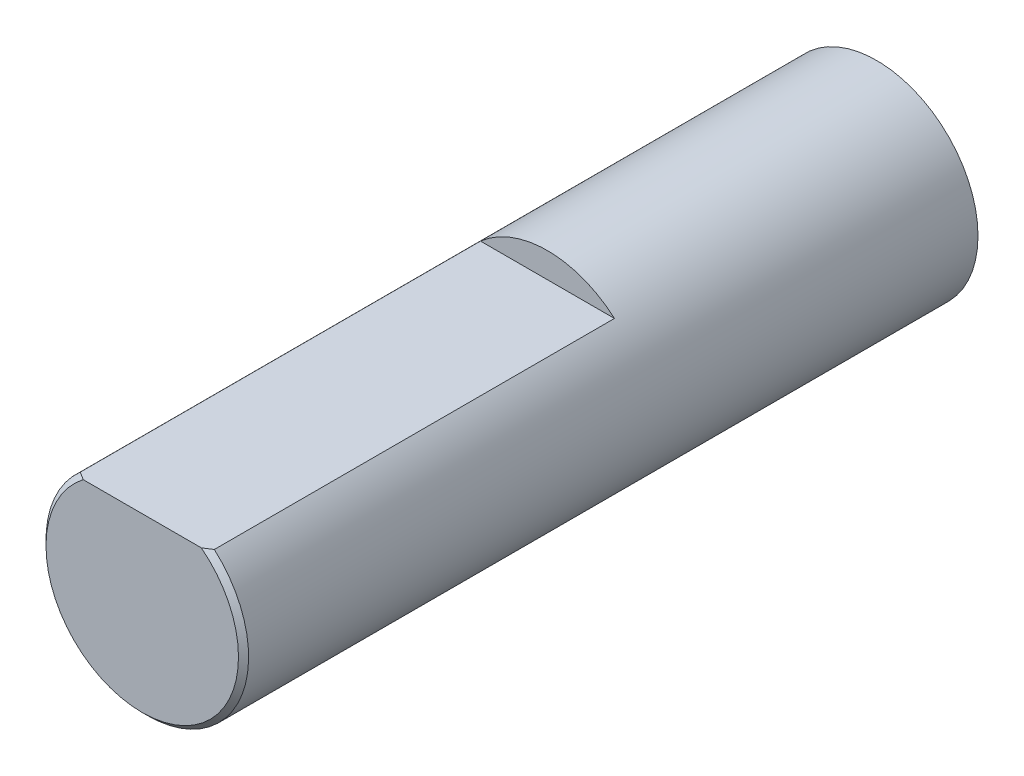
from build123d import *

# Parameters (mm, degrees)
SKETCH1_R           = 2
BOSS_EXTRUDE1_DEPTH = 14.5
CUT_EXTRUDE1_START  = -8
CUT_EXTRUDE1_DEPTH  = 8
CHAMFER1_SIZE       = 0.1


with BuildPart() as part:
    # Sketch1 → Boss-Extrude1 (new body)
    with BuildSketch(Plane.XY):
        Circle(SKETCH1_R)
    extrude(amount=BOSS_EXTRUDE1_DEPTH)

    # Sketch2 → Cut-Extrude1 (cut)
    with BuildSketch(Plane.XY.offset(14.5).offset(CUT_EXTRUDE1_START)):
        with BuildLine():
            Line((-1.322875656, 1.5), (1.322875656, 1.5))
            ThreePointArc((1.322875656, 1.5), (0, 2), (-1.322875656, 1.5))
        make_face()
    extrude(amount=CUT_EXTRUDE1_DEPTH, mode=Mode.SUBTRACT)

    # Chamfer1
    chamfer1_edges = [part.edges().sort_by_distance(p)[0] for p in [
        (-0.822875656, -1.822875656, 14.5),
    ]]
    chamfer(chamfer1_edges, length=CHAMFER1_SIZE)


solid = part.part
